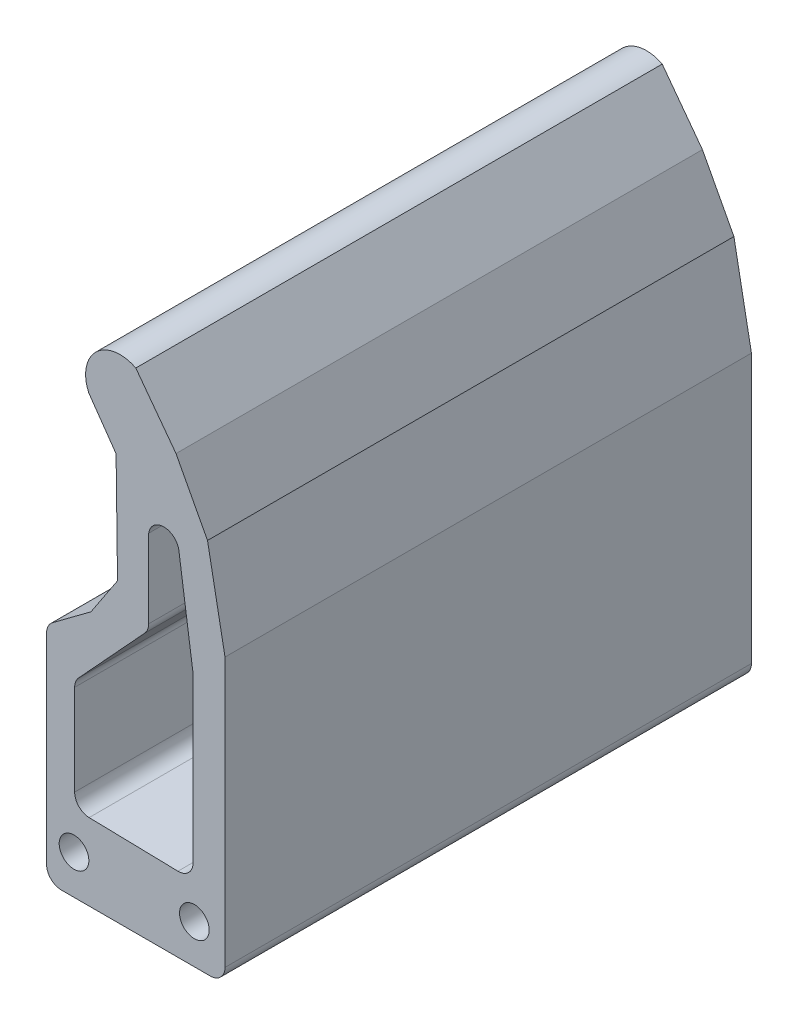
from build123d import *

# Parameters (mm, degrees)
BOSS_EXTRUDE1_DEPTH = 35.5
FILLET1_R           = 1
SKETCH2_R           = 1
CUT_EXTRUDE1_DEPTH  = 32


with BuildPart() as part:
    # Sketch1 → Boss-Extrude1 (new body)
    with BuildSketch(Plane.XY.offset(40)):
        with BuildLine():
            Line((-312.030492528, 377.868524993), (-310.193868717, 375.244776692))
            Line((-310.193868717, 375.244776692), (-310.096008301, 367.875213623))
            Line((-310.096008301, 367.875213623), (-311.889068604, 365.166412354))
            Line((-311.889068604, 365.166412354), (-314.88168335, 362.936676025))
            Line((-314.88168335, 362.936676025), (-314.88168335, 347.918438133))
            Line((-314.88168335, 347.918438133), (-302.847373473, 347.918438133))
            Line((-302.847373473, 347.918438133), (-302.847373473, 367.04556325))
            Line((-302.847373473, 367.04556325), (-304.028060208, 373.263846724))
            Line((-304.028060208, 373.263846724), (-306.153296332, 377.278181625))
            Line((-306.153296332, 377.278181625), (-308.864528411, 380.917030307))
            ThreePointArc((-308.864528411, 380.917030307), (-311.535911341, 380.523114569), (-312.030492528, 377.868524993))
        make_face()
        with BuildLine():
            Line((-312.988408734, 360.598376943), (-312.988408734, 353.109979303))
            Line((-312.988408734, 353.109979303), (-305, 352.927314193))
            Line((-305, 352.927314193), (-305, 365))
            Line((-305, 365), (-305.952850342, 371.670013428))
            ThreePointArc((-305.952850342, 371.670013428), (-306.959348498, 372.584855641), (-307.99460106, 371.702683918))
            Line((-307.99460106, 371.702683918), (-307.99460106, 366.023339102))
            Line((-307.99460106, 366.023339102), (-312.988408734, 360.598376943))
        make_face(mode=Mode.SUBTRACT)
    extrude(amount=BOSS_EXTRUDE1_DEPTH)

    # Fillet1
    fillet1_edges = [part.edges().sort_by_distance(p)[0] for p in [
        (-314.88168335, 347.918438133, 57.75),
        (-305, 352.927314193, 57.75),
        (-302.847373473, 347.918438133, 57.75),
        (-312.988408734, 353.109979303, 57.75),
        (-314.88168335, 362.936676025, 57.75),
        (-312.988408734, 360.598376943, 57.75),
        (-307.99460106, 366.023339102, 57.75),
    ]]
    fillet(fillet1_edges, radius=FILLET1_R)

    # Sketch2 → Cut-Extrude1 (cut)
    with BuildSketch(Plane.XY.offset(75.5)):
        with Locations((-313.031111026, 350.560286037)):
            Circle(SKETCH2_R)
        with Locations((-304.91451991, 350.560286037)):
            Circle(SKETCH2_R)
    extrude(amount=-CUT_EXTRUDE1_DEPTH, mode=Mode.SUBTRACT)


solid = part.part
